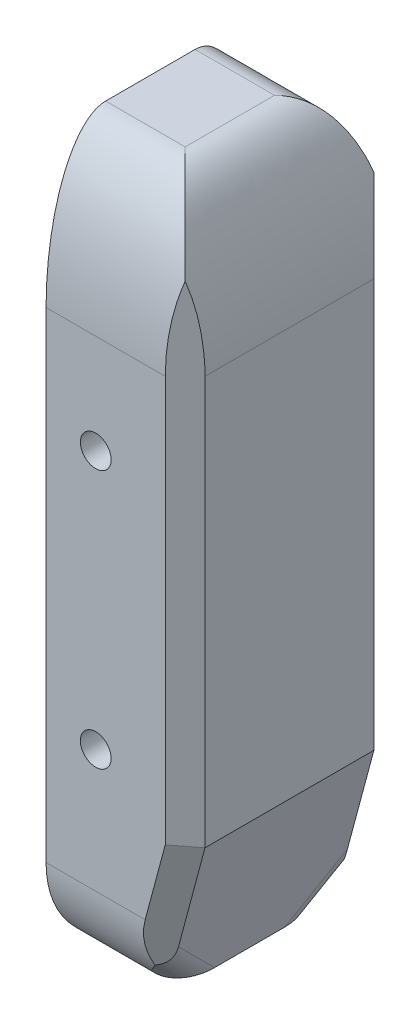
from build123d import *

# Parameters (mm, degrees)
BOSS_EXTRU_1_DEPTH      = 21
COQUE1_START            = 3.7
COQUE1_DEPTH            = 13.6
ESQUISSE2_R             = 1.55
ENL_V_MAT_EXTRU_1_DEPTH = 32.5
ESQUISSE3_R             = 2.95
ENL_V_MAT_EXTRU_2_DEPTH = 10
CHANFREIN4_SIZE         = 3.5
CHANFREIN1_SIZE         = 2
CONG_1_R                = 3
CONG_2_DEPTH            = 11.330684872
CONG_3_SIZE             = 15
CONG_3_SIZE_2           = 6
CONG_4_SIZE             = 15
CONG_4_SIZE_2           = 6
CONG_5_SIZE             = 6
CONG_5_SIZE_2           = 15
CONG_6_R                = 3


with BuildPart() as part:
    # Esquisse1 → Boss.-Extru.1 (new body)
    with BuildSketch(Plane.XY):
        Polygon((0, 0), (10, 0), (14, 14.92820323), (14, 71.03), (0, 71.03), align=None)
    extrude(amount=BOSS_EXTRU_1_DEPTH)

    # Coque1: read off the stored shape, not the designer's step
    # Coque1 outline → Coque1 (cut)
    with BuildSketch(Plane.XY.offset(COQUE1_START)):
        Polygon((0, 4), (7.241274902, 4), (10.3, 15.415317471), (10.3, 67.33), (0, 67.33), align=None)
    extrude(amount=COQUE1_DEPTH, mode=Mode.SUBTRACT)

    # Esquisse2 → Enlèv. mat.-Extru.1 (cut)
    with BuildSketch(Plane.XY.offset(21)):
        with Locations((5, 46.03)):
            Circle(ESQUISSE2_R)
        with Locations((5, 20)):
            Circle(ESQUISSE2_R)
    extrude(amount=-ENL_V_MAT_EXTRU_1_DEPTH, mode=Mode.SUBTRACT)

    # Esquisse3 → Enlèv. mat.-Extru.2 (cut)
    with BuildSketch(Plane.XZ):
        with Locations(Location((4, 10.5, 0), (0, 0, 270))):
            Circle(ESQUISSE3_R)
    extrude(amount=-ENL_V_MAT_EXTRU_2_DEPTH, mode=Mode.SUBTRACT)

    # Chanfrein4
    chanfrein4_edges = [part.edges().sort_by_distance(p)[0] for p in [
        (3.620637451, 4, 3.7),
        (3.620637451, 4, 17.3),
        (5, 0, 0),
        (5, 0, 21),
    ]]
    chamfer(chanfrein4_edges, length=CHANFREIN4_SIZE)

    # Chanfrein1
    chanfrein1_edges = [part.edges().sort_by_distance(p)[0] for p in [
        (14, 42.979101615, 21),
        (14, 42.979101615, 0),
        (12.468911087, 9.214101615, 0),
        (12.468911087, 9.214101615, 21),
    ]]
    chamfer(chanfrein1_edges, length=CHANFREIN1_SIZE)

    # Congé1
    cong_1_edges = [part.edges().sort_by_distance(p)[0] for p in [
        (10.200961894, 0.75, 2.75),
        (10.200961894, 0.75, 18.25),
    ]]
    fillet(cong_1_edges, radius=CONG_1_R)

    # Congé2: read off the stored shape, not the designer's step
    # Congé2 outline → Congé2 (cut)
    with BuildSketch(Plane.YZ):
        with BuildLine():
            Line((3.5, 0), (7.642135624, 0))
            ThreePointArc((7.642135624, 0), (3.8153013, 0.761204675), (0.571067812, 2.928932188))
            Line((0.571067812, 2.928932188), (3.5, 0))
        make_face()
        with BuildLine():
            ThreePointArc((0.571067812, 18.071067812), (3.8153013, 20.238795325), (7.642135624, 21))
            Line((7.642135624, 21), (3.5, 21))
            Line((3.5, 21), (0.571067812, 18.071067812))
        make_face()
    extrude(amount=CONG_2_DEPTH, mode=Mode.SUBTRACT)

    # Congé3
    # a fillet whose section is not a circle: 15, 6 mm, written as the material it takes off along each edge
    with BuildSketch(Plane(origin=(49.5, 71.03, 21), x_dir=(0, -1, 0), z_dir=(-1, 0, 0))) as cong_3_piece_1:
        with BuildLine():
            Bezier((CONG_3_SIZE, 0), (0, 0), (0, -CONG_3_SIZE_2), weights=[1, 0.707106781, 1])
            Line((0, -CONG_3_SIZE_2), (0, 0))
            Line((0, 0), (CONG_3_SIZE, 0))
        make_face()
    extrude(amount=87, mode=Mode.SUBTRACT)

    # Congé4
    # a fillet whose section is not a circle: 15, 6 mm, written as the material it takes off along each edge
    with BuildSketch(Plane(origin=(49.5, 71.03, 0), x_dir=(0, -1, 0), z_dir=(-1, 0, 0))) as cong_4_piece_1:
        with BuildLine():
            Bezier((CONG_4_SIZE, 0), (0, 0), (0, CONG_4_SIZE_2), weights=[1, 0.707106781, 1])
            Line((0, CONG_4_SIZE_2), (0, 0))
            Line((0, 0), (CONG_4_SIZE, 0))
        make_face()
    extrude(amount=87, mode=Mode.SUBTRACT)

    # Congé5
    # a fillet whose section is not a circle: 15, 6 mm, written as the material it takes off along each edge
    with BuildSketch(Plane(origin=(14, 71.03, -31.5), x_dir=(-1, 0, 0), z_dir=(0, 0, 1))) as cong_5_piece_1:
        with BuildLine():
            Bezier((CONG_5_SIZE, 0), (0, 0), (0, CONG_5_SIZE_2), weights=[1, 0.707106781, 1])
            Line((0, CONG_5_SIZE_2), (0, 0))
            Line((0, 0), (CONG_5_SIZE, 0))
        make_face()
    extrude(amount=84, mode=Mode.SUBTRACT)

    # Congé6
    cong_6_edges = [part.edges().sort_by_distance(p)[0] for p in [
        (5.15, 67.33, 3.7),
        (5.15, 67.33, 17.3),
    ]]
    fillet(cong_6_edges, radius=CONG_6_R)


solid = part.part
